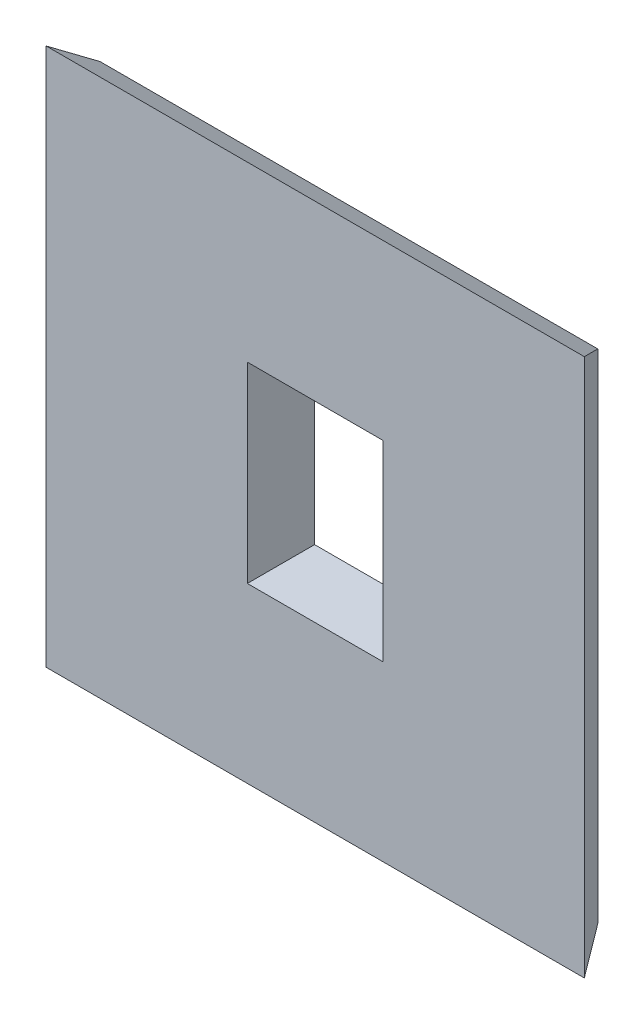
from build123d import *

# Parameters (mm, degrees)
CROQUIS1_W              = 59.8
CROQUIS1_H              = 59.8
CROQUIS1_W_2            = 20.2
CROQUIS1_H_2            = 28.5
SALIENTE_EXTRUIR1_DEPTH = 10
CROQUIS1_3_W            = 20.2
CROQUIS1_3_H            = 28.5
CORTAR_EXTRUIR1_DEPTH   = 10
CROQUIS1_4_W            = 80
CROQUIS1_4_H            = 80
CROQUIS1_4_W_2          = 59.8
CROQUIS1_4_H_2          = 59.8
SALIENTE_EXTRUIR2_DEPTH = 5
CHAFL_N2_START          = -40
CHAFL_N2_DEPTH          = 80
CHAFL_N2_START_2        = -41
CHAFL_N2_2_DEPTH        = 82


with BuildPart() as part:
    # Croquis1 → Saliente-Extruir1 (new body)
    # profile 1 of 2: a face of its own
    with BuildSketch(Plane.XY):
        Rectangle(CROQUIS1_W, CROQUIS1_H)
        Rectangle(CROQUIS1_W_2, CROQUIS1_H_2, mode=Mode.SUBTRACT)
    # profile 2 of 2: a face of its own
    with BuildSketch(Plane.XY):
        Rectangle(CROQUIS1_W_2, CROQUIS1_H_2)
    extrude(amount=-SALIENTE_EXTRUIR1_DEPTH)

    # Croquis1<3> → Cortar-Extruir1 (cut)
    with BuildSketch(Plane.XY):
        Rectangle(CROQUIS1_3_W, CROQUIS1_3_H)
    extrude(amount=-CORTAR_EXTRUIR1_DEPTH, mode=Mode.SUBTRACT)

    # Croquis1<4> → Saliente-Extruir2 (add)
    with BuildSketch(Plane.XY):
        Rectangle(CROQUIS1_4_W, CROQUIS1_4_H)
        Rectangle(CROQUIS1_4_W_2, CROQUIS1_4_H_2, mode=Mode.SUBTRACT)
    extrude(amount=-SALIENTE_EXTRUIR2_DEPTH)

    # Chaflán2: read off the stored shape, not the designer's step
    # Chaflán2 outline → Chaflán2 (cut)
    with BuildSketch(Plane(origin=(0, 0, 0), x_dir=(1, 0, 0), z_dir=(0, 1, 0)).offset(CHAFL_N2_START)):
        Polygon((-40, 5), (-40, 0), (-37, 5), align=None)
        Polygon((40, 5), (37, 5), (40, 0), align=None)
    extrude(amount=CHAFL_N2_DEPTH, mode=Mode.SUBTRACT)

    # Chafl_n2 2 outline → Chafl_n2 2 (cut)
    with BuildSketch(Plane.YZ.offset(CHAFL_N2_START_2)):
        Polygon((40, -5), (40, 0), (37, -5), align=None)
        Polygon((-40, -5), (-37, -5), (-40, 0), align=None)
    extrude(amount=CHAFL_N2_2_DEPTH, mode=Mode.SUBTRACT)


solid = part.part
